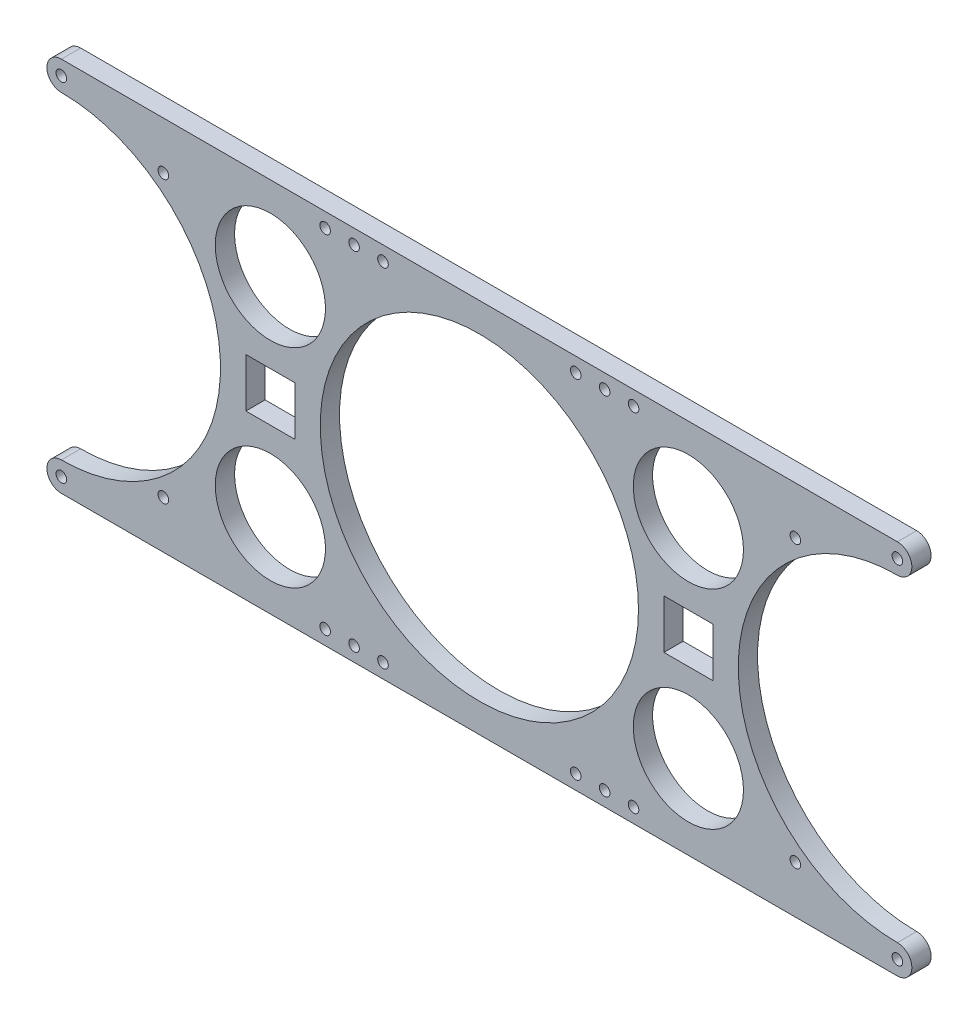
from build123d import *

# Parameters (mm, degrees)
SKETCH1_R            = 82.55
SKETCH1_R_2          = 28.575
SKETCH1_W            = 25.4
SKETCH1_H            = 25.4
BOSS_EXTRUDE1_DEPTH  = 5
M5_CLEARANCE_HOLE1_D = 5.5


with BuildPart() as part:
    # Sketch1 → Boss-Extrude1 (new, symmetric)
    with BuildSketch(Plane.XY):
        with BuildLine():
            Line((-216.868301049, 97.55), (216.868301049, 97.55))
            ThreePointArc((216.868301049, 97.55), (224.368301049, 90.05), (216.868301049, 82.55))
            ThreePointArc((216.868301049, 82.55), (134.318301049, 0), (216.868301049, -82.55))
            ThreePointArc((216.868301049, -82.55), (224.368301049, -90.05), (216.868301049, -97.55))
            Line((216.868301049, -97.55), (-216.868301049, -97.55))
            ThreePointArc((-216.868301049, -97.55), (-224.368301049, -90.05), (-216.868301049, -82.55))
            ThreePointArc((-216.868301049, -82.55), (-134.318301049, 0), (-216.868301049, 82.55))
            ThreePointArc((-216.868301049, 82.55), (-224.368301049, 90.05), (-216.868301049, 97.55))
        make_face()
        Circle(SKETCH1_R, mode=Mode.SUBTRACT)
        with Locations((108.434150525, 53.975)):
            Circle(SKETCH1_R_2, mode=Mode.SUBTRACT)
        with Locations((108.434150525, -53.975)):
            Circle(SKETCH1_R_2, mode=Mode.SUBTRACT)
        with Locations((-108.434150525, -53.975)):
            Circle(SKETCH1_R_2, mode=Mode.SUBTRACT)
        with Locations((-108.434150525, 53.975)):
            Circle(SKETCH1_R_2, mode=Mode.SUBTRACT)
        with Locations((-108.434150525, 0)):
            Rectangle(SKETCH1_W, SKETCH1_H, mode=Mode.SUBTRACT)
        with Locations((108.434150525, 0)):
            Rectangle(SKETCH1_W, SKETCH1_H, mode=Mode.SUBTRACT)
    extrude(amount=BOSS_EXTRUDE1_DEPTH, both=True)

    # M5 Clearance Hole1 (through all)
    with Locations(Plane.XY.offset(5)):
        with Locations((-80, 90.05), (-65, 90.05), (-50, 90.05), (50, 90.05), (65, 90.05), (80, 90.05), (-80, -90.05), (-65, -90.05), (-50, -90.05), (50, -90.05), (65, -90.05), (80, -90.05), (-216.868301049, 90.05), (216.868301049, 90.05), (-216.868301049, -90.05), (216.868301049, -90.05), (-163.93823908, 72.851980343), (-163.93823908, -72.851980343), (163.93823908, 72.851980343), (163.93823908, -72.851980343)):
            Hole(M5_CLEARANCE_HOLE1_D / 2)


solid = part.part
